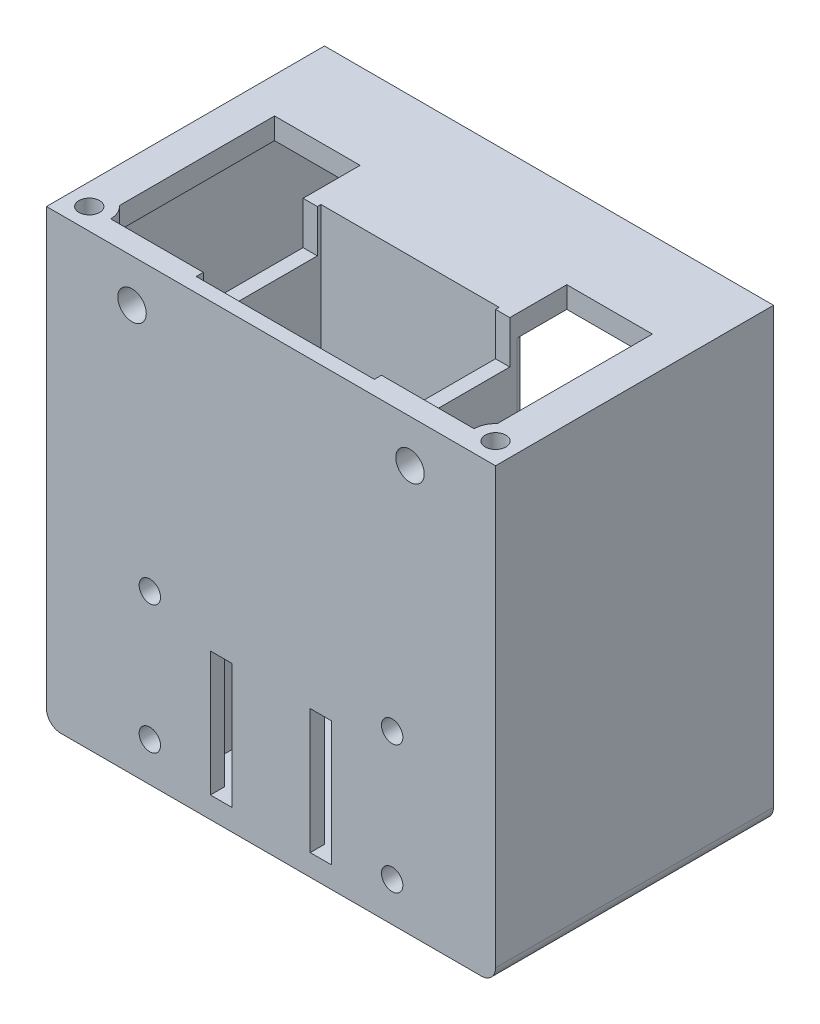
from build123d import *

# Parameters (mm, degrees)
CROQUIS1_W               = 63
CROQUIS1_H               = 63
CROQUIS1_R               = 2
CROQUIS1_R_2             = 1.5
CROQUIS1_W_2             = 3
CROQUIS1_H_2             = 12
SALIENTE_EXTRUIR1_DEPTH  = 3
CROQUIS2_W               = 63
CROQUIS2_H               = 63
CROQUIS2_W_2             = 57
CROQUIS2_H_2             = 57
SALIENTE_EXTRUIR2_DEPTH  = 36
CROQUIS4_W               = 25
CROQUIS4_H               = 17
CORTAR_EXTRUIR2_DEPTH    = 60
SALIENTE_EXTRUIR8_DEPTH  = 60
CROQUIS8_W               = 3
CROQUIS8_H               = 12
CORTAR_EXTRUIR4_DEPTH    = 63
CROQUIS10_R              = 3
SALIENTE_EXTRUIR6_DEPTH  = 20
CROQUIS11_R              = 1.45
CORTAR_EXTRUIR6_DEPTH    = 9
REDONDEO1_R              = 2
CROQUIS13_W              = 25
CROQUIS13_H              = 25
CORTAR_EXTRUIR7_DEPTH    = 3
CROQUIS14_W              = 12
CROQUIS14_H              = 20
CORTAR_EXTRUIR8_DEPTH    = 5
CROQUIS15_R              = 3
SALIENTE_EXTRUIR9_DEPTH  = 20
CROQUIS16_W              = 15
CROQUIS16_H              = 18
SALIENTE_EXTRUIR10_DEPTH = 8
CROQUIS17_R              = 1.45
CORTAR_EXTRUIR9_DEPTH    = 20
CROQUIS18_W              = 3
CROQUIS18_H              = 12
SALIENTE_EXTRUIR11_DEPTH = 3
CROQUIS19_W              = 3
CROQUIS19_H              = 12
SALIENTE_EXTRUIR12_DEPTH = 3
REDONDEO3_R              = 1
CROQUIS20_R              = 3.125
CROQUIS20_R_2            = 2.625
CORTAR_EXTRUIR10_DEPTH   = 3
CROQUIS21_W              = 18.835847929
CROQUIS21_H              = 19.895765468
CORTAR_EXTRUIR11_DEPTH   = 18
CROQUIS22_R              = 1.45
SALIENTE_EXTRUIR13_DEPTH = 3
CROQUIS23_W              = 29
CROQUIS23_H              = 16
CORTAR_EXTRUIR12_DEPTH   = 6
CROQUIS24_W              = 3
CROQUIS24_H              = 5.5
CORTAR_EXTRUIR13_DEPTH   = 6
CROQUIS25_W              = 3
CROQUIS25_H              = 5.5
CORTAR_EXTRUIR14_DEPTH   = 30
CROQUIS26_W              = 25
CROQUIS26_H              = 0.5
CORTAR_EXTRUIR15_DEPTH   = 60
CROQUIS28_W              = 12
CROQUIS28_H              = 4
CORTAR_EXTRUIR16_DEPTH   = 6
SALIENTE_EXTRUIR14_DEPTH = 4.6
SALIENTE_EXTRUIR15_DEPTH = 1.5
REDONDEO4_R              = 2
CROQUIS31_W              = 2
CROQUIS31_H              = 3
CORTAR_EXTRUIR17_DEPTH   = 2


with BuildPart() as part:
    # Croquis1 → Saliente-Extruir1 (new body)
    with BuildSketch(Plane.XY):
        with Locations((31.5, 31.5)):
            Rectangle(CROQUIS1_W, CROQUIS1_H)
        with Locations((12, 57)):
            Circle(CROQUIS1_R, mode=Mode.SUBTRACT)
        with Locations((51, 57)):
            Circle(CROQUIS1_R, mode=Mode.SUBTRACT)
        with Locations((14.5, 5.5)):
            Circle(CROQUIS1_R_2, mode=Mode.SUBTRACT)
        with Locations((14.5, 23.5)):
            Circle(CROQUIS1_R_2, mode=Mode.SUBTRACT)
        with Locations((48.5, 5.5)):
            Circle(CROQUIS1_R_2, mode=Mode.SUBTRACT)
        with Locations((48.5, 23.5)):
            Circle(CROQUIS1_R_2, mode=Mode.SUBTRACT)
        with Locations((24.5, 14.5)):
            Rectangle(CROQUIS1_W_2, CROQUIS1_H_2, mode=Mode.SUBTRACT)
        with Locations((38.5, 14.5)):
            Rectangle(CROQUIS1_W_2, CROQUIS1_H_2, mode=Mode.SUBTRACT)
    extrude(amount=SALIENTE_EXTRUIR1_DEPTH)

    # Croquis2 → Saliente-Extruir2 (add)
    with BuildSketch(Plane(origin=(0, 0, 0), x_dir=(-1, 0, 0), z_dir=(0, 0, -1))):
        with Locations((-31.5, 31.5)):
            Rectangle(CROQUIS2_W, CROQUIS2_H)
        with Locations((-31.5, 31.5)):
            Rectangle(CROQUIS2_W_2, CROQUIS2_H_2, mode=Mode.SUBTRACT)
    extrude(amount=SALIENTE_EXTRUIR2_DEPTH)

    # Croquis4 → Cortar-Extruir2 (cut)
    with BuildSketch(Plane(origin=(0, 63, 0), x_dir=(1, 0, 0), z_dir=(0, 1, 0))):
        with Locations((31.5, 7.5)):
            Rectangle(CROQUIS4_W, CROQUIS4_H)
    extrude(amount=-CORTAR_EXTRUIR2_DEPTH, mode=Mode.SUBTRACT)

    # Croquis12 → Saliente-Extruir8 (add)
    with BuildSketch(Plane(origin=(0, 63, 0), x_dir=(1, 0, 0), z_dir=(0, 1, 0))):
        Polygon((19, -1), (17, -1), (17, 18), (46, 18), (46, -1), (44, -1), (44, 16), (19, 16), align=None)
    extrude(amount=-SALIENTE_EXTRUIR8_DEPTH)

    # Croquis8 → Cortar-Extruir4 (cut)
    with BuildSketch(Plane.ZY):
        with Locations((-1.5, 14.5)):
            Rectangle(CROQUIS8_W, CROQUIS8_H)
    extrude(amount=-CORTAR_EXTRUIR4_DEPTH, mode=Mode.SUBTRACT)

    # Croquis10 → Saliente-Extruir6 (add)
    with BuildSketch(Plane(origin=(0, 0, -36), x_dir=(-1, 0, 0), z_dir=(0, 0, -1))):
        with Locations((-3, 3)):
            Circle(CROQUIS10_R)
        with Locations((-60, 3)):
            Circle(CROQUIS10_R)
    extrude(amount=-SALIENTE_EXTRUIR6_DEPTH)

    # Croquis11 → Cortar-Extruir6 (cut)
    with BuildSketch(Plane(origin=(0, 0, -36), x_dir=(-1, 0, 0), z_dir=(0, 0, -1))):
        with Locations((-60, 3)):
            Circle(CROQUIS11_R)
        with Locations((-3, 3)):
            Circle(CROQUIS11_R)
    extrude(amount=-CORTAR_EXTRUIR6_DEPTH, mode=Mode.SUBTRACT)

    # Redondeo1
    redondeo1_edges = [part.edges().sort_by_distance(p)[0] for p in [
        (63, 0, -16.5),
        (0, 0, -16.5),
    ]]
    fillet(redondeo1_edges, radius=REDONDEO1_R)

    # Croquis13 → Cortar-Extruir7 (cut)
    with BuildSketch(Plane(origin=(0, 0, -18), x_dir=(-1, 0, 0), z_dir=(0, 0, -1))):
        with Locations((-31.5, 15.5)):
            Rectangle(CROQUIS13_W, CROQUIS13_H)
    extrude(amount=-CORTAR_EXTRUIR7_DEPTH, mode=Mode.SUBTRACT)

    # Croquis14 → Cortar-Extruir8 (cut)
    with BuildSketch(Plane(origin=(0, 63, 0), x_dir=(1, 0, 0), z_dir=(0, 1, 0))):
        with Locations((52, 10)):
            Rectangle(CROQUIS14_W, CROQUIS14_H)
        with Locations((11, 10)):
            Rectangle(CROQUIS14_W, CROQUIS14_H)
    extrude(amount=-CORTAR_EXTRUIR8_DEPTH, mode=Mode.SUBTRACT)

    # Croquis15 → Saliente-Extruir9 (add)
    with BuildSketch(Plane(origin=(0, 63, 0), x_dir=(1, 0, 0), z_dir=(0, 1, 0))):
        with Locations((3, 0)):
            Circle(CROQUIS15_R)
        with Locations((60, 0)):
            Circle(CROQUIS15_R)
        with Locations(Location((31.5, 31, 0), (0, 0, 270))):
            Circle(CROQUIS15_R)
    extrude(amount=-SALIENTE_EXTRUIR9_DEPTH)

    # Croquis16 → Saliente-Extruir10 (add)
    with BuildSketch(Plane.XZ.offset(-60)):
        with Locations((31.5, -27)):
            Rectangle(CROQUIS16_W, CROQUIS16_H)
    extrude(amount=SALIENTE_EXTRUIR10_DEPTH)

    # Croquis17 → Cortar-Extruir9 (cut)
    with BuildSketch(Plane(origin=(0, 63, 0), x_dir=(1, 0, 0), z_dir=(0, 1, 0))):
        with Locations(Location((3, 0, 0), (0, 0, 270))):
            Circle(CROQUIS17_R)
        with Locations(Location((60, 0, 0), (0, 0, 270))):
            Circle(CROQUIS17_R)
        with Locations(Location((31.5, 31, 0), (0, 0, 270))):
            Circle(CROQUIS17_R)
    extrude(amount=-CORTAR_EXTRUIR9_DEPTH, mode=Mode.SUBTRACT)

    # Croquis18 → Saliente-Extruir11 (add)
    with BuildSketch(Plane(origin=(63, 0, 0), x_dir=(0, 0, -1), z_dir=(1, 0, 0))):
        with Locations((1.5, 14.5)):
            Rectangle(CROQUIS18_W, CROQUIS18_H)
    extrude(amount=-SALIENTE_EXTRUIR11_DEPTH)

    # Croquis19 → Saliente-Extruir12 (add)
    with BuildSketch(Plane.ZY):
        with Locations((-1.5, 14.5)):
            Rectangle(CROQUIS19_W, CROQUIS19_H)
    extrude(amount=-SALIENTE_EXTRUIR12_DEPTH)

    # Redondeo3
    redondeo3_edges = [part.edges().sort_by_distance(p)[0] for p in [
        (31.5, 28, -18),
        (44, 15.5, -18),
        (19, 15.5, -18),
        (46, 31.5, -18),
        (17, 31.5, -18),
        (39, 52, -27),
        (24, 52, -27),
        (39, 56, -36),
        (24, 56, -36),
        (31.5, 52, -36),
    ]]
    fillet(redondeo3_edges, radius=REDONDEO3_R - 0.0001)  # a hair under: the kernel refuses the full size

    # Croquis20 → Cortar-Extruir10 (cut)
    with BuildSketch(Plane.XZ):
        with Locations(Location((10, -4, 0), (0, 0, 270))):
            Circle(CROQUIS20_R)
        with Locations(Location((10, -14, 0), (0, 0, 270))):
            Circle(CROQUIS20_R_2)
    extrude(amount=-CORTAR_EXTRUIR10_DEPTH, mode=Mode.SUBTRACT)

    # Croquis21 → Cortar-Extruir11 (cut)
    with BuildSketch(Plane(origin=(0, 0, -36), x_dir=(-1, 0, 0), z_dir=(0, 0, -1))):
        with Locations((-31.895496214, 50.052117266)):
            Rectangle(CROQUIS21_W, CROQUIS21_H)
    extrude(amount=-CORTAR_EXTRUIR11_DEPTH, mode=Mode.SUBTRACT)

    # Croquis22 → Saliente-Extruir13 (add)
    with BuildSketch(Plane(origin=(0, 63, 0), x_dir=(1, 0, 0), z_dir=(0, 1, 0))):
        with Locations((31.5, 31)):
            Circle(CROQUIS22_R)
    extrude(amount=-SALIENTE_EXTRUIR13_DEPTH)

    # Croquis23 → Cortar-Extruir12 (cut)
    with BuildSketch(Plane(origin=(0, 63, 0), x_dir=(1, 0, 0), z_dir=(0, 1, 0))):
        with Locations((31.5, 8)):
            Rectangle(CROQUIS23_W, CROQUIS23_H)
    extrude(amount=-CORTAR_EXTRUIR12_DEPTH, mode=Mode.SUBTRACT)

    # Croquis24 → Cortar-Extruir13 (cut)
    with BuildSketch(Plane(origin=(0, 0, 1), x_dir=(-1, 0, 0), z_dir=(0, 0, -1))):
        with Locations((-38.5, 5.75)):
            Rectangle(CROQUIS24_W, CROQUIS24_H)
        with Locations((-24.5, 5.75)):
            Rectangle(CROQUIS24_W, CROQUIS24_H)
    extrude(amount=-CORTAR_EXTRUIR13_DEPTH, mode=Mode.SUBTRACT)

    # Croquis25 → Cortar-Extruir14 (cut)
    with BuildSketch(Plane(origin=(46, 0, 0), x_dir=(0, 0, -1), z_dir=(1, 0, 0))):
        with Locations((1.5, 5.75)):
            Rectangle(CROQUIS25_W, CROQUIS25_H)
    extrude(amount=-CORTAR_EXTRUIR14_DEPTH, mode=Mode.SUBTRACT)

    # Croquis26 → Cortar-Extruir15 (cut)
    with BuildSketch(Plane(origin=(0, 63, 0), x_dir=(1, 0, 0), z_dir=(0, 1, 0))):
        with Locations((31.5, 16.25)):
            Rectangle(CROQUIS26_W, CROQUIS26_H)
    extrude(amount=-CORTAR_EXTRUIR15_DEPTH, mode=Mode.SUBTRACT)

    # Croquis28 → Cortar-Extruir16 (cut)
    with BuildSketch(Plane(origin=(0, 63, 0), x_dir=(1, 0, 0), z_dir=(0, 1, 0))):
        with Locations((11, 22)):
            Rectangle(CROQUIS28_W, CROQUIS28_H)
        with Locations((52, 22)):
            Rectangle(CROQUIS28_W, CROQUIS28_H)
    extrude(amount=-CORTAR_EXTRUIR16_DEPTH, mode=Mode.SUBTRACT)

    # Croquis29 → Saliente-Extruir14 (add)
    with BuildSketch(Plane.ZY):
        Polygon((-36, 10), (-15, 10), (-15, 12), (-15, 47), (-17, 47), (-17, 12), (-34, 12), (-34, 47), (-36, 47), (-36, 12), align=None)
    extrude(amount=SALIENTE_EXTRUIR14_DEPTH)

    # Croquis30 → Saliente-Extruir15 (add)
    with BuildSketch(Plane.ZY.offset(4.6)):
        Polygon((-36, 10), (-15, 10), (-15, 14), (-15, 47), (-19, 47), (-19, 14), (-32, 14), (-32, 47), (-36, 47), (-36, 14), align=None)
    extrude(amount=SALIENTE_EXTRUIR15_DEPTH)

    # Redondeo4
    redondeo4_edges = [part.edges().sort_by_distance(p)[0] for p in [
        (-3.05, 10, -36),
        (-3.05, 10, -15),
        (-6.1, 28.5, -36),
        (-6.1, 10, -25.5),
        (-6.1, 28.5, -15),
    ]]
    fillet(redondeo4_edges, radius=REDONDEO4_R)

    # Croquis31 → Cortar-Extruir17 (cut)
    with BuildSketch(Plane.ZY.offset(6.1)):
        with Locations((-33, 45.5)):
            Rectangle(CROQUIS31_W, CROQUIS31_H)
    extrude(amount=-CORTAR_EXTRUIR17_DEPTH, mode=Mode.SUBTRACT)


solid = part.part
